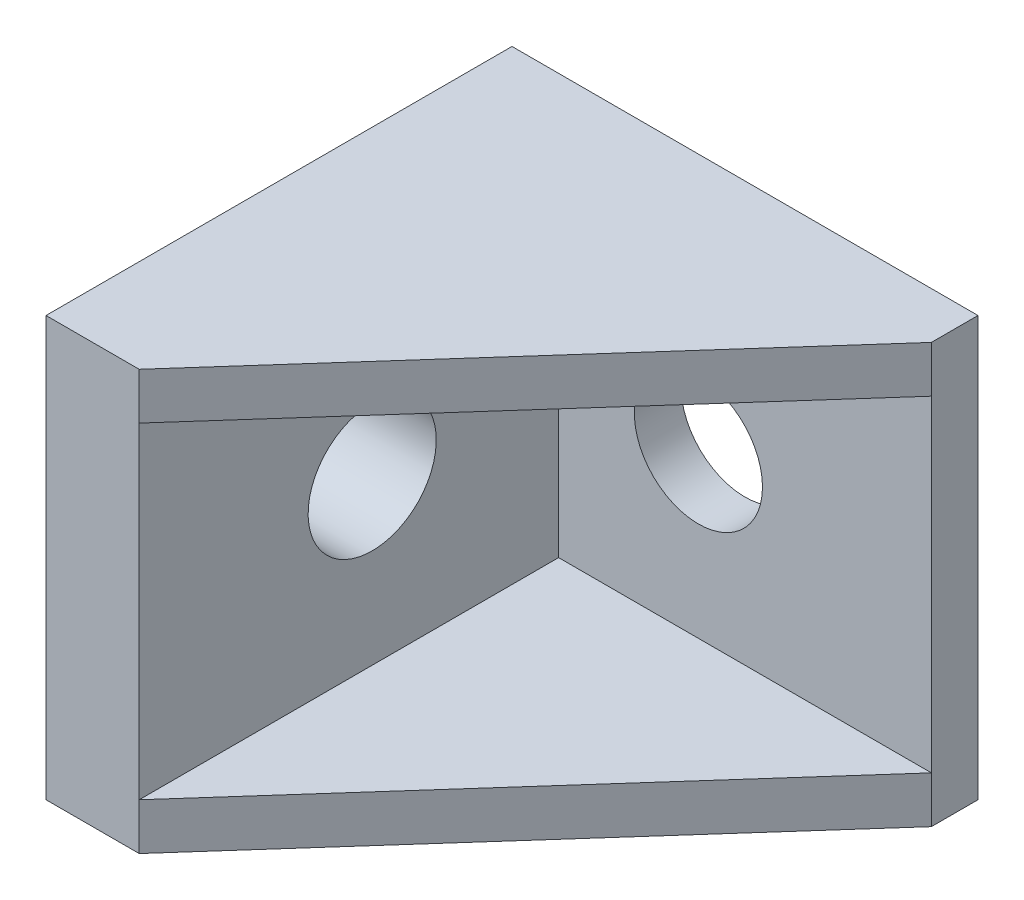
from build123d import *

# Parameters (mm, degrees)
SKETCH_1_W               = 20
SKETCH_1_H               = 18
EXTRUDE_1_DEPTH          = 20
SKETCH_2_W               = 16
SKETCH_2_H               = 14
CUT_EXTRUDE_1_DEPTH      = 18
CUT_EXTRUDE_2_DEPTH      = 28.49545417
CUT_EXTRUDE_2_DEPTH_BACK = 28.49545417
CUT_EXTRUDE_3_DEPTH      = 23.472205054
CUT_EXTRUDE_3_DEPTH_BACK = 23.472205054
SKETCH_5_R               = 2.75
CUT_EXTRUDE_4_DEPTH      = 28.147743921
CUT_EXTRUDE_4_DEPTH_BACK = 28.147743921
SKETCH_6_R               = 2.75


with BuildPart() as part:
    # 스케치1 → 보스-돌출1 (new body)
    with BuildSketch(Plane.XY):
        Rectangle(SKETCH_1_W, SKETCH_1_H)
    extrude(amount=EXTRUDE_1_DEPTH)

    # 스케치2 → 컷-돌출1 (cut)
    with BuildSketch(Plane.XY.offset(20)):
        with Locations((2, 0)):
            Rectangle(SKETCH_2_W, SKETCH_2_H)
    extrude(amount=-CUT_EXTRUDE_1_DEPTH, mode=Mode.SUBTRACT)

    # 스케치4 → 컷-돌출2 (cut, two sides: drawn at the far end of the back side and taken through both)
    with BuildSketch(Plane(origin=(0, -7, 0), x_dir=(1, 0, 0), z_dir=(0, 1, 0)).offset(-CUT_EXTRUDE_2_DEPTH_BACK)):
        Polygon((-6, -20), (10, -2), (10, -20), align=None)
    extrude(amount=CUT_EXTRUDE_2_DEPTH + CUT_EXTRUDE_2_DEPTH_BACK, mode=Mode.SUBTRACT)

    # 스케치5 → 컷-돌출3 (cut, two sides: drawn at the far end of the back side and taken through both)
    with BuildSketch(Plane.XY.offset(2).offset(-CUT_EXTRUDE_3_DEPTH_BACK)):
        Circle(SKETCH_5_R)
    extrude(amount=CUT_EXTRUDE_3_DEPTH + CUT_EXTRUDE_3_DEPTH_BACK, mode=Mode.SUBTRACT)

    # 스케치6 → 컷-돌출4 (cut, two sides: drawn at the far end of the back side and taken through both)
    with BuildSketch(Plane(origin=(-6, 0, 0), x_dir=(0, 0, -1), z_dir=(1, 0, 0)).offset(-CUT_EXTRUDE_4_DEPTH_BACK)):
        with Locations((-10, 0)):
            Circle(SKETCH_6_R)
    extrude(amount=CUT_EXTRUDE_4_DEPTH + CUT_EXTRUDE_4_DEPTH_BACK, mode=Mode.SUBTRACT)


solid = part.part
